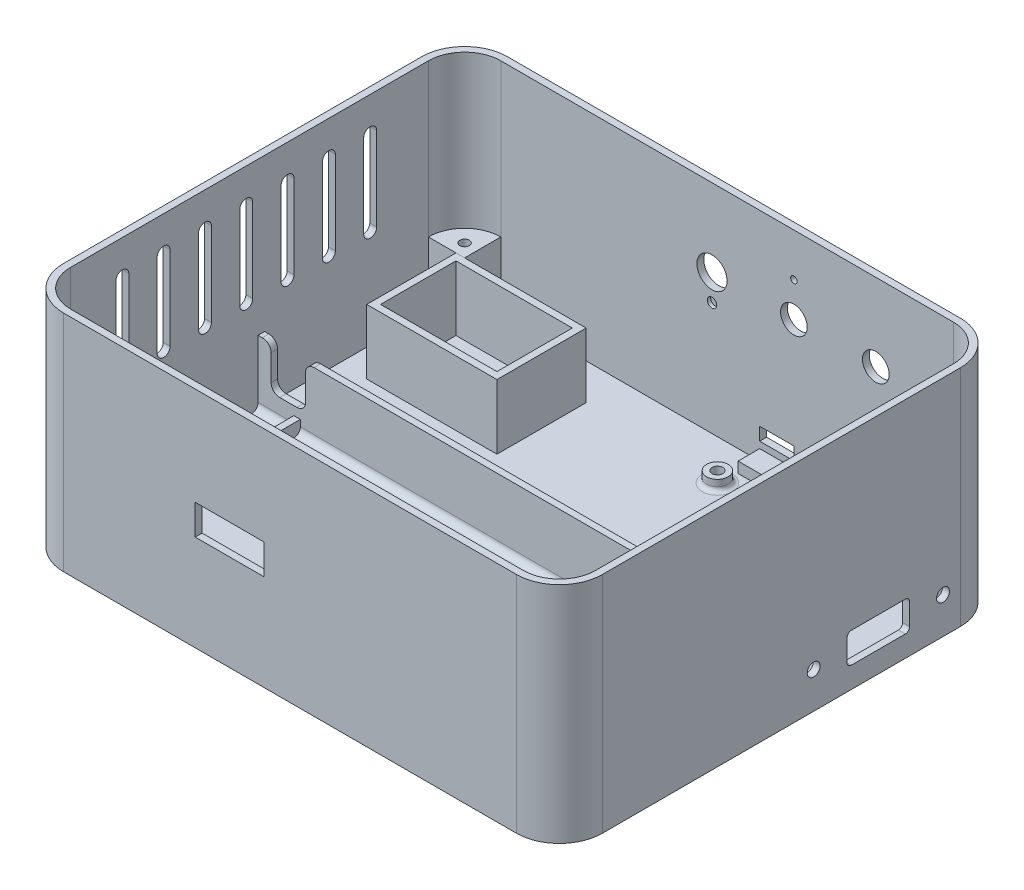
from build123d import *

# Parameters (mm, degrees)
AUFSATZ_LINEAR_AUSTRAGEN1_DEPTH  = 52
SCHALE1_T                        = -1.6
SKIZZE5_W                        = 8.4
SKIZZE5_H                        = 8.4
AUFSATZ_LINEAR_AUSTRAGEN4_DEPTH  = 15
SKIZZE6_R                        = 1.1
SCHNITT_LINEAR_AUSTRAGEN1_DEPTH  = 16.6
SCHNITT_LINEAR_AUSTRAGEN2_REACH  = 170.94
SKIZZE9_W                        = 43.5
SKIZZE9_H                        = 13.3
SKIZZE10_W                       = 48.3
SKIZZE10_H                       = 8.4
SKIZZE10_W_2                     = 121.8
SKIZZE10_H_2                     = 1.5
AUFSATZ_LINEAR_AUSTRAGEN5_DEPTH  = 3
VERRUNDUNG1_R                    = 1.5
SKIZZE11_W                       = 121.8
SKIZZE11_H                       = 1.5
AUFSATZ_LINEAR_AUSTRAGEN6_DEPTH  = 12
AUFSATZ_LINEAR_AUSTRAGEN9_DEPTH  = 1.6
AUFSATZ_LINEAR_AUSTRAGEN10_REACH = 170.762
SKIZZE19_W                       = 1.5
SKIZZE19_H                       = 43.5
SCHNITT_LINEAR_AUSTRAGEN3_REACH  = 172.112
SCHNITT_LINEAR_AUSTRAGEN4_REACH  = 172.112
SKIZZE21_W                       = 16
SKIZZE21_H                       = 7
SKIZZE22_R                       = 2.25
SCHNITT_LINEAR_AUSTRAGEN7_DEPTH  = 12.6
SCHNITT_LINEAR_AUSTRAGEN8_REACH  = 172.112
SKIZZE23_R                       = 3.1
SKIZZE23_R_2                     = 0.75
SCHNITT_LINEAR_AUSTRAGEN9_REACH  = 171.148
SKIZZE24_W                       = 9
SKIZZE24_H                       = 6
SKIZZE25_W                       = 3.2
SKIZZE25_H                       = 4.8
SKIZZE25_H_2                     = 3
AUFSATZ_LINEAR_AUSTRAGEN11_DEPTH = 7.5
SCHNITT_LINEAR_AUSTRAGEN10_REACH = 171.148
SKIZZE26_W                       = 8
SKIZZE26_H                       = 3
SKIZZE27_R                       = 2.5
SKIZZE27_R_2                     = 1.25
SKIZZE27_W                       = 4
SKIZZE27_H                       = 5
AUFSATZ_LINEAR_AUSTRAGEN12_DEPTH = 2.5
VERRUNDUNG4_R                    = 1
SKIZZE29_R                       = 3.5
SCHNITT_LINEAR_AUSTRAGEN11_DEPTH = 0.9
SKIZZE30_W                       = 8
SKIZZE30_H                       = 1.5
SCHNITT_LINEAR_AUSTRAGEN12_DEPTH = 10
VERRUNDUNG5_R                    = 2
SCHNITT_LINEAR_AUSTRAGEN13_REACH = 170.94
SKIZZE31_R                       = 1.5
SKIZZE31_W                       = 14.5
SKIZZE31_H                       = 7
VERRUNDUNG6_R                    = 1
VERRUNDUNG7_R                    = 1
SCHNITT_LINEAR_AUSTRAGEN14_REACH = 172.112
SKIZZE32_R                       = 3.5
SKIZZE33_R                       = 1.1
SCHNITT_LINEAR_AUSTRAGEN15_DEPTH = 0.8
SKIZZE12_W                       = 27
SKIZZE12_H                       = 17.5
AUFSATZ_LINEAR_AUSTRAGEN7_DEPTH  = 15
SKIZZE34_W                       = 9
SKIZZE34_H                       = 2.5
SCHNITT_LINEAR_AUSTRAGEN17_DEPTH = 1.6


with BuildPart() as part:
    # Skizze1 → Aufsatz-Linear austragen1 (new body)
    with BuildSketch(Plane(origin=(0, 0, 0), x_dir=(1, 0, 0), z_dir=(0, 1, 0))):
        with BuildLine():
            Line((10, 0), (115, 0))
            ThreePointArc((115, 0), (122.071067812, 2.928932188), (125, 10))
            Line((125, 10), (125, 93))
            ThreePointArc((125, 93), (122.071067812, 100.071067812), (115, 103))
            Line((115, 103), (10, 103))
            ThreePointArc((10, 103), (2.928932188, 100.071067812), (0, 93))
            Line((0, 93), (0, 10))
            ThreePointArc((0, 10), (2.928932188, 2.928932188), (10, 0))
        make_face()
    extrude(amount=AUFSATZ_LINEAR_AUSTRAGEN1_DEPTH)

    # Schale1
    schale1_openings = [part.faces().sort_by_distance(p)[0] for p in [
        (62.5, 52, -51.5),
    ]]
    offset(amount=SCHALE1_T, openings=schale1_openings, kind=Kind.INTERSECTION)

    # Skizze5 → Aufsatz-Linear austragen4 (add)
    with BuildSketch(Plane(origin=(0, 1.6, 0), x_dir=(1, 0, 0), z_dir=(0, 1, 0))):
        with BuildLine():
            Line((1.6, 93), (10, 93))
            Line((10, 93), (10, 101.4))
            ThreePointArc((10, 101.4), (4.060303038, 98.939696962), (1.6, 93))
        make_face()
        with BuildLine():
            Line((115, 93), (115, 101.4))
            ThreePointArc((115, 101.4), (120.939696962, 98.939696962), (123.4, 93))
            Line((123.4, 93), (115, 93))
        make_face()
        with BuildLine():
            Line((123.4, 10), (115, 10))
            Line((115, 10), (115, 1.6))
            ThreePointArc((115, 1.6), (120.939696962, 4.060303038), (123.4, 10))
        make_face()
        with BuildLine():
            Line((10, 10), (10, 1.6))
            ThreePointArc((10, 1.6), (4.060303038, 4.060303038), (1.6, 10))
            Line((1.6, 10), (10, 10))
        make_face()
        with Locations((62.5, 5.8)):
            Rectangle(SKIZZE5_W, SKIZZE5_H)
    extrude(amount=AUFSATZ_LINEAR_AUSTRAGEN4_DEPTH)

    # Skizze6 → Schnitt-Linear austragen1 (cut)
    with BuildSketch(Plane(origin=(0, 16.6, 0), x_dir=(1, 0, 0), z_dir=(0, 1, 0))):
        with Locations(Location((7, 96, 0), (0, 0, 270))):
            Circle(SKIZZE6_R)
        with Locations(Location((118, 96, 0), (0, 0, 270))):
            Circle(SKIZZE6_R)
        with Locations(Location((118, 7, 0), (0, 0, 270))):
            Circle(SKIZZE6_R)
        with Locations(Location((7, 7, 0), (0, 0, 270))):
            Circle(SKIZZE6_R)
    extrude(amount=-SCHNITT_LINEAR_AUSTRAGEN1_DEPTH, mode=Mode.SUBTRACT)

    # Skizze9 → Schnitt-Linear austragen2 (cut, up to next)
    with BuildSketch(Plane(origin=(1.6, 0, 0), x_dir=(0, 0, -1), z_dir=(1, 0, 0)), mode=Mode.PRIVATE) as schnitt_linear_austragen2_sk1:
        with Locations((31.75, 8.25)):
            Rectangle(SKIZZE9_W, SKIZZE9_H)
    schnitt_linear_austragen2_tool1 = extrude(schnitt_linear_austragen2_sk1.sketch, amount=-SCHNITT_LINEAR_AUSTRAGEN2_REACH, mode=Mode.PRIVATE) & part.part
    add(schnitt_linear_austragen2_tool1.solids().sort_by_distance((1.6, 8.25, -31.75))[0], mode=Mode.SUBTRACT)

    # Skizze10 → Aufsatz-Linear austragen5 (add)
    with BuildSketch(Plane(origin=(0, 1.6, 0), x_dir=(1, 0, 0), z_dir=(0, 1, 0))):
        with Locations((90.85, 5.8)):
            Rectangle(SKIZZE10_W, SKIZZE10_H)
        with Locations((34.15, 5.8)):
            Rectangle(SKIZZE10_W, SKIZZE10_H)
        with Locations((62.5, 54.25)):
            Rectangle(SKIZZE10_W_2, SKIZZE10_H_2)
    extrude(amount=AUFSATZ_LINEAR_AUSTRAGEN5_DEPTH)

    # Verrundung1
    verrundung1_edges = [part.edges().sort_by_distance(p)[0] for p in [
        (61.7, 1.6, -53.5),
        (61.7, 1.6, -10),
    ]]
    fillet(verrundung1_edges, radius=VERRUNDUNG1_R)

    # Skizze11 → Aufsatz-Linear austragen6 (add)
    with BuildSketch(Plane(origin=(0, 4.6, 0), x_dir=(1, 0, 0), z_dir=(0, 1, 0))):
        with Locations((62.5, 54.25)):
            Rectangle(SKIZZE11_W, SKIZZE11_H)
    extrude(amount=AUFSATZ_LINEAR_AUSTRAGEN6_DEPTH)

    # Skizze16 → Aufsatz-Linear austragen9 (add)
    with BuildSketch(Plane.ZY):
        with BuildLine():
            Line((-10, 14.9), (-10, 3.1))
            ThreePointArc((-10, 3.1), (-10.439339828, 2.039339828), (-11.5, 1.6))
            Line((-11.5, 1.6), (-52, 1.6))
            ThreePointArc((-52, 1.6), (-53.060660172, 2.039339828), (-53.5, 3.1))
            Line((-53.5, 3.1), (-53.5, 14.9))
            Line((-53.5, 14.9), (-10, 14.9))
        make_face()
    extrude(amount=-AUFSATZ_LINEAR_AUSTRAGEN9_DEPTH)

    # Skizze19 → Aufsatz-Linear austragen10 (add, up to next)
    with BuildSketch(Plane(origin=(0, 4.6, 0), x_dir=(1, 0, 0), z_dir=(0, 1, 0)), mode=Mode.PRIVATE) as aufsatz_linear_austragen10_sk1:
        with Locations((10.65, 31.75)):
            Rectangle(SKIZZE19_W, SKIZZE19_H)
    aufsatz_linear_austragen10_tool1 = extrude(aufsatz_linear_austragen10_sk1.sketch, amount=-AUFSATZ_LINEAR_AUSTRAGEN10_REACH, mode=Mode.PRIVATE) - part.part
    add(aufsatz_linear_austragen10_tool1.solids().sort_by_distance((10.65, 4.6, -31.75))[0])

    # Skizze20 → Schnitt-Linear austragen3 (cut, up to next)
    with BuildSketch(Plane.ZY, mode=Mode.PRIVATE) as schnitt_linear_austragen3_sk1:
        with BuildLine():
            Line((-78, 44), (-78, 24.6))
            ThreePointArc((-78, 24.6), (-79.5, 23.1), (-81, 24.6))
            Line((-81, 24.6), (-81, 44))
            ThreePointArc((-81, 44), (-79.5, 45.5), (-78, 44))
        make_face()
    schnitt_linear_austragen3_tool1 = extrude(schnitt_linear_austragen3_sk1.sketch, amount=-SCHNITT_LINEAR_AUSTRAGEN3_REACH, mode=Mode.PRIVATE) & part.part
    # Skizze20 → Schnitt-Linear austragen3 (cut, up to next)
    with BuildSketch(Plane.ZY, mode=Mode.PRIVATE) as schnitt_linear_austragen3_sk2:
        with BuildLine():
            Line((-68.416666667, 44), (-68.416666667, 24.6))
            ThreePointArc((-68.416666667, 24.6), (-69.916666667, 23.1), (-71.416666667, 24.6))
            Line((-71.416666667, 24.6), (-71.416666667, 44))
            ThreePointArc((-71.416666667, 44), (-69.916666667, 45.5), (-68.416666667, 44))
        make_face()
    schnitt_linear_austragen3_tool2 = extrude(schnitt_linear_austragen3_sk2.sketch, amount=-SCHNITT_LINEAR_AUSTRAGEN3_REACH, mode=Mode.PRIVATE) & part.part
    # Skizze20 → Schnitt-Linear austragen3 (cut, up to next)
    with BuildSketch(Plane.ZY, mode=Mode.PRIVATE) as schnitt_linear_austragen3_sk3:
        with BuildLine():
            Line((-58.833333333, 44), (-58.833333333, 24.6))
            ThreePointArc((-58.833333333, 24.6), (-60.333333333, 23.1), (-61.833333333, 24.6))
            Line((-61.833333333, 24.6), (-61.833333333, 44))
            ThreePointArc((-61.833333333, 44), (-60.333333333, 45.5), (-58.833333333, 44))
        make_face()
    schnitt_linear_austragen3_tool3 = extrude(schnitt_linear_austragen3_sk3.sketch, amount=-SCHNITT_LINEAR_AUSTRAGEN3_REACH, mode=Mode.PRIVATE) & part.part
    # Skizze20 → Schnitt-Linear austragen3 (cut, up to next)
    with BuildSketch(Plane.ZY, mode=Mode.PRIVATE) as schnitt_linear_austragen3_sk4:
        with BuildLine():
            Line((-49.25, 44), (-49.25, 24.6))
            ThreePointArc((-49.25, 24.6), (-50.75, 23.1), (-52.25, 24.6))
            Line((-52.25, 24.6), (-52.25, 44))
            ThreePointArc((-52.25, 44), (-50.75, 45.5), (-49.25, 44))
        make_face()
    schnitt_linear_austragen3_tool4 = extrude(schnitt_linear_austragen3_sk4.sketch, amount=-SCHNITT_LINEAR_AUSTRAGEN3_REACH, mode=Mode.PRIVATE) & part.part
    # Skizze20 → Schnitt-Linear austragen3 (cut, up to next)
    with BuildSketch(Plane.ZY, mode=Mode.PRIVATE) as schnitt_linear_austragen3_sk5:
        with BuildLine():
            Line((-39.666666667, 44), (-39.666666667, 24.6))
            ThreePointArc((-39.666666667, 24.6), (-41.166666667, 23.1), (-42.666666667, 24.6))
            Line((-42.666666667, 24.6), (-42.666666667, 44))
            ThreePointArc((-42.666666667, 44), (-41.166666667, 45.5), (-39.666666667, 44))
        make_face()
    schnitt_linear_austragen3_tool5 = extrude(schnitt_linear_austragen3_sk5.sketch, amount=-SCHNITT_LINEAR_AUSTRAGEN3_REACH, mode=Mode.PRIVATE) & part.part
    # Skizze20 → Schnitt-Linear austragen3 (cut, up to next)
    with BuildSketch(Plane.ZY, mode=Mode.PRIVATE) as schnitt_linear_austragen3_sk6:
        with BuildLine():
            Line((-30.083333333, 44), (-30.083333333, 24.6))
            ThreePointArc((-30.083333333, 24.6), (-31.583333333, 23.1), (-33.083333333, 24.6))
            Line((-33.083333333, 24.6), (-33.083333333, 44))
            ThreePointArc((-33.083333333, 44), (-31.583333333, 45.5), (-30.083333333, 44))
        make_face()
    schnitt_linear_austragen3_tool6 = extrude(schnitt_linear_austragen3_sk6.sketch, amount=-SCHNITT_LINEAR_AUSTRAGEN3_REACH, mode=Mode.PRIVATE) & part.part
    # Skizze20 → Schnitt-Linear austragen3 (cut, up to next)
    with BuildSketch(Plane.ZY, mode=Mode.PRIVATE) as schnitt_linear_austragen3_sk7:
        with BuildLine():
            Line((-20.5, 44), (-20.5, 24.6))
            ThreePointArc((-20.5, 24.6), (-22, 23.1), (-23.5, 24.6))
            Line((-23.5, 24.6), (-23.5, 44))
            ThreePointArc((-23.5, 44), (-22, 45.5), (-20.5, 44))
        make_face()
    schnitt_linear_austragen3_tool7 = extrude(schnitt_linear_austragen3_sk7.sketch, amount=-SCHNITT_LINEAR_AUSTRAGEN3_REACH, mode=Mode.PRIVATE) & part.part
    add(schnitt_linear_austragen3_tool1.solids().sort_by_distance((0, 34.3, -79.5))[0], mode=Mode.SUBTRACT)
    add(schnitt_linear_austragen3_tool2.solids().sort_by_distance((0, 34.3, -69.916667))[0], mode=Mode.SUBTRACT)
    add(schnitt_linear_austragen3_tool3.solids().sort_by_distance((0, 34.3, -60.333333))[0], mode=Mode.SUBTRACT)
    add(schnitt_linear_austragen3_tool4.solids().sort_by_distance((0, 34.3, -50.75))[0], mode=Mode.SUBTRACT)
    add(schnitt_linear_austragen3_tool5.solids().sort_by_distance((0, 34.3, -41.166667))[0], mode=Mode.SUBTRACT)
    add(schnitt_linear_austragen3_tool6.solids().sort_by_distance((0, 34.3, -31.583333))[0], mode=Mode.SUBTRACT)
    add(schnitt_linear_austragen3_tool7.solids().sort_by_distance((0, 34.3, -22))[0], mode=Mode.SUBTRACT)

    # Skizze21 → Schnitt-Linear austragen4 (cut, up to next)
    with BuildSketch(Plane.XY, mode=Mode.PRIVATE) as schnitt_linear_austragen4_sk1:
        with Locations((48.5, 25.75)):
            Rectangle(SKIZZE21_W, SKIZZE21_H)
    schnitt_linear_austragen4_tool1 = extrude(schnitt_linear_austragen4_sk1.sketch, amount=-SCHNITT_LINEAR_AUSTRAGEN4_REACH, mode=Mode.PRIVATE) & part.part
    add(schnitt_linear_austragen4_tool1.solids().sort_by_distance((48.5, 25.75, 0))[0], mode=Mode.SUBTRACT)

    # Skizze22 → Schnitt-Linear austragen7 (cut)
    with BuildSketch(Plane.XZ):
        with Locations(Location((118, -96, 0), (0, 0, 270))):
            Circle(SKIZZE22_R)
        with Locations(Location((7, -96, 0), (0, 0, 270))):
            Circle(SKIZZE22_R)
        with Locations(Location((7, -7, 0), (0, 0, 270))):
            Circle(SKIZZE22_R)
        with Locations(Location((118, -7, 0), (0, 0, 270))):
            Circle(SKIZZE22_R)
    extrude(amount=-SCHNITT_LINEAR_AUSTRAGEN7_DEPTH, mode=Mode.SUBTRACT)

    # Skizze23 → Schnitt-Linear austragen8 (cut, up to next)
    with BuildSketch(Plane(origin=(0, 0, -103), x_dir=(-1, 0, 0), z_dir=(0, 0, -1)), mode=Mode.PRIVATE) as schnitt_linear_austragen8_sk1:
        with Locations((-97, 34)):
            Circle(SKIZZE23_R)
    schnitt_linear_austragen8_tool1 = extrude(schnitt_linear_austragen8_sk1.sketch, amount=-SCHNITT_LINEAR_AUSTRAGEN8_REACH, mode=Mode.PRIVATE) & part.part
    # Skizze23 → Schnitt-Linear austragen8 (cut, up to next)
    with BuildSketch(Plane(origin=(0, 0, -103), x_dir=(-1, 0, 0), z_dir=(0, 0, -1)), mode=Mode.PRIVATE) as schnitt_linear_austragen8_sk2:
        with Locations((-78, 34)):
            Circle(SKIZZE23_R)
    schnitt_linear_austragen8_tool2 = extrude(schnitt_linear_austragen8_sk2.sketch, amount=-SCHNITT_LINEAR_AUSTRAGEN8_REACH, mode=Mode.PRIVATE) & part.part
    # Skizze23 → Schnitt-Linear austragen8 (cut, up to next)
    with BuildSketch(Plane(origin=(0, 0, -103), x_dir=(-1, 0, 0), z_dir=(0, 0, -1)), mode=Mode.PRIVATE) as schnitt_linear_austragen8_sk3:
        with Locations((-78, 42)):
            Circle(SKIZZE23_R_2)
    schnitt_linear_austragen8_tool3 = extrude(schnitt_linear_austragen8_sk3.sketch, amount=-SCHNITT_LINEAR_AUSTRAGEN8_REACH, mode=Mode.PRIVATE) & part.part
    add(schnitt_linear_austragen8_tool1.solids().sort_by_distance((97, 34, -103))[0], mode=Mode.SUBTRACT)
    add(schnitt_linear_austragen8_tool2.solids().sort_by_distance((78, 34, -103))[0], mode=Mode.SUBTRACT)
    add(schnitt_linear_austragen8_tool3.solids().sort_by_distance((78, 42, -103))[0], mode=Mode.SUBTRACT)

    # Skizze24 → Schnitt-Linear austragen9 (cut, up to next)
    with BuildSketch(Plane.XY.offset(-101.4), mode=Mode.PRIVATE) as schnitt_linear_austragen9_sk1:
        with Locations((92.5, 5.6)):
            Rectangle(SKIZZE24_W, SKIZZE24_H)
    schnitt_linear_austragen9_tool1 = extrude(schnitt_linear_austragen9_sk1.sketch, amount=-SCHNITT_LINEAR_AUSTRAGEN9_REACH, mode=Mode.PRIVATE) & part.part
    add(schnitt_linear_austragen9_tool1.solids().sort_by_distance((92.5, 5.6, -101.4))[0], mode=Mode.SUBTRACT)

    # Skizze25 → Aufsatz-Linear austragen11 (add)
    with BuildSketch(Plane(origin=(0, 1.6, 0), x_dir=(1, 0, 0), z_dir=(0, 1, 0))):
        with Locations((83.025, 99)):
            Rectangle(SKIZZE25_W, SKIZZE25_H)
        with Locations((101.975, 99)):
            Rectangle(SKIZZE25_W, SKIZZE25_H)
        with Locations((83.025, 93.95)):
            Rectangle(SKIZZE25_W, SKIZZE25_H_2)
        with Locations((101.975, 93.95)):
            Rectangle(SKIZZE25_W, SKIZZE25_H_2)
    extrude(amount=AUFSATZ_LINEAR_AUSTRAGEN11_DEPTH)

    # Skizze26 → Schnitt-Linear austragen10 (cut, up to next)
    with BuildSketch(Plane.XY.offset(-101.4), mode=Mode.PRIVATE) as schnitt_linear_austragen10_sk1:
        with Locations((74.06, 7.1)):
            Rectangle(SKIZZE26_W, SKIZZE26_H)
    schnitt_linear_austragen10_tool1 = extrude(schnitt_linear_austragen10_sk1.sketch, amount=-SCHNITT_LINEAR_AUSTRAGEN10_REACH, mode=Mode.PRIVATE) & part.part
    add(schnitt_linear_austragen10_tool1.solids().sort_by_distance((74.06, 7.1, -101.4))[0], mode=Mode.SUBTRACT)

    # Skizze27 → Aufsatz-Linear austragen12 (add)
    # profile 1 of 4: a face of its own
    with BuildSketch(Plane(origin=(0, 1.6, 0), x_dir=(1, 0, 0), z_dir=(0, 1, 0))):
        with Locations((69.56, 92.1)):
            Circle(SKIZZE27_R)
        with Locations(Location((69.56, 92.1, 0), (0, 0, 90))):
            Circle(SKIZZE27_R_2, mode=Mode.SUBTRACT)
    # profile 2 of 4: a face of its own
    with BuildSketch(Plane(origin=(0, 1.6, 0), x_dir=(1, 0, 0), z_dir=(0, 1, 0))):
        with Locations(Location((78.56, 92.1, 0), (0, 0, 90))):
            Circle(SKIZZE27_R)
        with Locations((78.56, 92.1)):
            Circle(SKIZZE27_R_2, mode=Mode.SUBTRACT)
    # profile 3 of 4: a face of its own
    with BuildSketch(Plane(origin=(0, 1.6, 0), x_dir=(1, 0, 0), z_dir=(0, 1, 0))):
        with Locations((76.06, 98.9)):
            Rectangle(SKIZZE27_W, SKIZZE27_H)
    # profile 4 of 4: a face of its own
    with BuildSketch(Plane(origin=(0, 1.6, 0), x_dir=(1, 0, 0), z_dir=(0, 1, 0))):
        with Locations((72.06, 98.9)):
            Rectangle(SKIZZE27_W, SKIZZE27_H)
    extrude(amount=AUFSATZ_LINEAR_AUSTRAGEN12_DEPTH)

    # Verrundung4
    # the kernel refuses this fillet: 1 mm, written as the material it adds along each edge
    with BuildSketch(Plane(origin=(69.56, 1.6, -92.1), x_dir=(1, 0, 0), z_dir=(0, 0, 1))) as verrundung4_piece_1:
        with BuildLine():
            CenterArc((2.5 + VERRUNDUNG4_R, VERRUNDUNG4_R), VERRUNDUNG4_R, 180, 90)
            Line((2.5, VERRUNDUNG4_R), (2.5, 0))
            Line((2.5, 0), (2.5 + VERRUNDUNG4_R, 0))
        make_face()
    revolve(axis=Axis((69.56, 1.6, -92.1), (0, 1, 0)))
    with BuildSketch(Plane(origin=(78.56, 1.6, -92.1), x_dir=(0, 0, -1), z_dir=(1, 0, 0))) as verrundung4_piece_2:
        with BuildLine():
            CenterArc((2.5 + VERRUNDUNG4_R, VERRUNDUNG4_R), VERRUNDUNG4_R, 180, 90)
            Line((2.5, VERRUNDUNG4_R), (2.5, 0))
            Line((2.5, 0), (2.5 + VERRUNDUNG4_R, 0))
        make_face()
    revolve(axis=Axis((78.56, 1.6, -92.1), (0, 1, 0)))

    # Skizze29 → Schnitt-Linear austragen11 (cut)
    with BuildSketch(Plane.XY.offset(-1.6)):
        with Locations(Location((69.5, 25.35, 0), (0, 0, 180))):
            Circle(SKIZZE29_R)
    extrude(amount=SCHNITT_LINEAR_AUSTRAGEN11_DEPTH, mode=Mode.SUBTRACT)

    # Skizze30 → Schnitt-Linear austragen12 (cut)
    with BuildSketch(Plane(origin=(0, 16.6, 0), x_dir=(1, 0, 0), z_dir=(0, 1, 0))):
        with Locations((8.6, 54.25)):
            Rectangle(SKIZZE30_W, SKIZZE30_H)
    extrude(amount=-SCHNITT_LINEAR_AUSTRAGEN12_DEPTH, mode=Mode.SUBTRACT)

    # Verrundung5
    verrundung5_edges = [part.edges().sort_by_distance(p)[0] for p in [
        (12.6, 6.6, -54.25),
        (4.6, 6.6, -54.25),
        (12.6, 16.6, -54.25),
        (4.6, 16.6, -54.25),
    ]]
    fillet(verrundung5_edges, radius=VERRUNDUNG5_R)

    # Skizze31 → Schnitt-Linear austragen13 (cut, up to next)
    with BuildSketch(Plane.ZY.offset(-123.4), mode=Mode.PRIVATE) as schnitt_linear_austragen13_sk1:
        with Locations((-59, 8.4)):
            Circle(SKIZZE31_R)
    schnitt_linear_austragen13_tool1 = extrude(schnitt_linear_austragen13_sk1.sketch, amount=-SCHNITT_LINEAR_AUSTRAGEN13_REACH, mode=Mode.PRIVATE) & part.part
    # Skizze31 → Schnitt-Linear austragen13 (cut, up to next)
    with BuildSketch(Plane.ZY.offset(-123.4), mode=Mode.PRIVATE) as schnitt_linear_austragen13_sk2:
        with Locations((-89, 8.4)):
            Circle(SKIZZE31_R)
    schnitt_linear_austragen13_tool2 = extrude(schnitt_linear_austragen13_sk2.sketch, amount=-SCHNITT_LINEAR_AUSTRAGEN13_REACH, mode=Mode.PRIVATE) & part.part
    # Skizze31 → Schnitt-Linear austragen13 (cut, up to next)
    with BuildSketch(Plane.ZY.offset(-123.4), mode=Mode.PRIVATE) as schnitt_linear_austragen13_sk3:
        with Locations((-74, 8.4)):
            Rectangle(SKIZZE31_W, SKIZZE31_H)
    schnitt_linear_austragen13_tool3 = extrude(schnitt_linear_austragen13_sk3.sketch, amount=-SCHNITT_LINEAR_AUSTRAGEN13_REACH, mode=Mode.PRIVATE) & part.part
    add(schnitt_linear_austragen13_tool1.solids().sort_by_distance((123.4, 8.4, -59))[0], mode=Mode.SUBTRACT)
    add(schnitt_linear_austragen13_tool2.solids().sort_by_distance((123.4, 8.4, -89))[0], mode=Mode.SUBTRACT)
    add(schnitt_linear_austragen13_tool3.solids().sort_by_distance((123.4, 8.4, -74))[0], mode=Mode.SUBTRACT)

    # Verrundung6
    verrundung6_edges = [part.edges().sort_by_distance(p)[0] for p in [
        (124.2, 4.9, -81.25),
        (124.2, 11.9, -81.25),
        (124.2, 11.9, -66.75),
        (124.2, 4.9, -66.75),
    ]]
    fillet(verrundung6_edges, radius=VERRUNDUNG6_R)

    # Verrundung7
    # the kernel refuses this fillet: 1 mm, written as the material it adds along each edge
    with BuildSketch(Plane(origin=(81.425, 1.6, -91.610416623), x_dir=(-1, 0, 0), z_dir=(0, 0, -1))) as verrundung7_piece_1_section:
        with BuildLine():
            CenterArc((VERRUNDUNG7_R, VERRUNDUNG7_R), VERRUNDUNG7_R, 180, 90)
            Line((0, VERRUNDUNG7_R), (0, 0))
            Line((0, 0), (VERRUNDUNG7_R, 0))
        make_face()
    verrundung7_piece_1 = extrude(amount=3.839583377, mode=Mode.PRIVATE)
    verrundung7_piece_1 = split(verrundung7_piece_1, bisect_by=Plane(origin=(81.263865527, 1.903531011, -92.45), z_dir=(0, 0, -1)), keep=Keep.TOP, mode=Mode.PRIVATE)
    add(verrundung7_piece_1)
    with BuildSketch(Plane(origin=(81.425, 1.6, -91.610416623), x_dir=(-1, 0, 0), z_dir=(0, 0, -1))) as verrundung7_piece_2_section:
        with BuildLine():
            CenterArc((VERRUNDUNG7_R, VERRUNDUNG7_R), VERRUNDUNG7_R, 180, 90)
            Line((0, VERRUNDUNG7_R), (0, 0))
            Line((0, 0), (VERRUNDUNG7_R, 0))
        make_face()
    verrundung7_piece_2 = extrude(amount=6.339583377, mode=Mode.PRIVATE)
    verrundung7_piece_2 = split(verrundung7_piece_2, bisect_by=Plane(origin=(81.201632061, 1.823367939, -96.6), z_dir=(0, 0, -1)), keep=Keep.TOP, mode=Mode.PRIVATE)
    add(verrundung7_piece_2)
    with BuildSketch(Plane(origin=(81.425, 1.6, -94.1), x_dir=(-1, 0, 0), z_dir=(0, 0, -1))) as verrundung7_piece_3_section:
        with BuildLine():
            CenterArc((VERRUNDUNG7_R, VERRUNDUNG7_R), VERRUNDUNG7_R, 180, 90)
            Line((0, VERRUNDUNG7_R), (0, 0))
            Line((0, 0), (VERRUNDUNG7_R, 0))
        make_face()
    verrundung7_piece_3 = extrude(amount=9.8, mode=Mode.PRIVATE)
    verrundung7_piece_3 = split(verrundung7_piece_3, bisect_by=Plane(origin=(81.224124387, 1.866931824, -95.45), z_dir=(0, 0, 1)), keep=Keep.TOP, mode=Mode.PRIVATE)
    add(verrundung7_piece_3)
    with BuildSketch(Plane(origin=(81.425, 1.6, -96.6), x_dir=(-1, 0, 0), z_dir=(0, 0, -1)), Plane(origin=(84.625, 1.6, -101.4), x_dir=(1, 0, 0), z_dir=(0, 0, 1)), Plane(origin=(100.375, 1.6, -96.6), x_dir=(-1, 0, 0), z_dir=(0, 0, -1)), Plane(origin=(103.575, 1.6, -101.4), x_dir=(1, 0, 0), z_dir=(0, 0, 1))) as verrundung7_piece_4:
        with BuildLine():
            CenterArc((VERRUNDUNG7_R, VERRUNDUNG7_R), VERRUNDUNG7_R, 180, 90)
            Line((0, VERRUNDUNG7_R), (0, 0))
            Line((0, 0), (VERRUNDUNG7_R, 0))
        make_face()
    extrude(amount=4.8)
    with BuildSketch(Plane(origin=(84.625, 1.6, -103.9), x_dir=(1, 0, 0), z_dir=(0, 0, 1))) as verrundung7_piece_5_section:
        with BuildLine():
            CenterArc((VERRUNDUNG7_R, VERRUNDUNG7_R), VERRUNDUNG7_R, 180, 90)
            Line((0, VERRUNDUNG7_R), (0, 0))
            Line((0, 0), (VERRUNDUNG7_R, 0))
        make_face()
    verrundung7_piece_5 = extrude(amount=9.8, mode=Mode.PRIVATE)
    verrundung7_piece_5 = split(verrundung7_piece_5, bisect_by=Plane(origin=(84.848367939, 1.823367939, -95.45), z_dir=(0, 0, 1)), keep=Keep.TOP, mode=Mode.PRIVATE)
    add(verrundung7_piece_5)
    with BuildSketch(Plane(origin=(84.625, 1.6, -97.95), x_dir=(1, 0, 0), z_dir=(0, 0, 1))) as verrundung7_piece_6_section:
        with BuildLine():
            CenterArc((VERRUNDUNG7_R, VERRUNDUNG7_R), VERRUNDUNG7_R, 180, 90)
            Line((0, VERRUNDUNG7_R), (0, 0))
            Line((0, 0), (VERRUNDUNG7_R, 0))
        make_face()
    verrundung7_piece_6 = extrude(amount=8, mode=Mode.PRIVATE)
    verrundung7_piece_6 = split(verrundung7_piece_6, bisect_by=Plane(origin=(84.848367939, 1.823367939, -96.6), z_dir=(0, 0, -1)), keep=Keep.TOP, mode=Mode.PRIVATE)
    add(verrundung7_piece_6)
    with BuildSketch(Plane(origin=(84.625, 1.6, -95.45), x_dir=(1, 0, 0), z_dir=(0, 0, 1)), Plane(origin=(100.375, 1.6, -92.45), x_dir=(-1, 0, 0), z_dir=(0, 0, -1)), Plane(origin=(103.575, 1.6, -95.45), x_dir=(1, 0, 0), z_dir=(0, 0, 1))) as verrundung7_piece_7:
        with BuildLine():
            CenterArc((VERRUNDUNG7_R, VERRUNDUNG7_R), VERRUNDUNG7_R, 180, 90)
            Line((0, VERRUNDUNG7_R), (0, 0))
            Line((0, 0), (VERRUNDUNG7_R, 0))
        make_face()
    extrude(amount=3)
    with BuildSketch(Plane(origin=(100.375, 1.6, -94.1), x_dir=(-1, 0, 0), z_dir=(0, 0, -1))) as verrundung7_piece_8_section:
        with BuildLine():
            CenterArc((VERRUNDUNG7_R, VERRUNDUNG7_R), VERRUNDUNG7_R, 180, 90)
            Line((0, VERRUNDUNG7_R), (0, 0))
            Line((0, 0), (VERRUNDUNG7_R, 0))
        make_face()
    verrundung7_piece_8 = extrude(amount=9.8, mode=Mode.PRIVATE)
    verrundung7_piece_8 = split(verrundung7_piece_8, bisect_by=Plane(origin=(100.151632061, 1.823367939, -95.45), z_dir=(0, 0, 1)), keep=Keep.TOP, mode=Mode.PRIVATE)
    add(verrundung7_piece_8)
    with BuildSketch(Plane(origin=(100.375, 1.6, -89.95), x_dir=(-1, 0, 0), z_dir=(0, 0, -1))) as verrundung7_piece_9_section:
        with BuildLine():
            CenterArc((VERRUNDUNG7_R, VERRUNDUNG7_R), VERRUNDUNG7_R, 180, 90)
            Line((0, VERRUNDUNG7_R), (0, 0))
            Line((0, 0), (VERRUNDUNG7_R, 0))
        make_face()
    verrundung7_piece_9 = extrude(amount=8, mode=Mode.PRIVATE)
    verrundung7_piece_9 = split(verrundung7_piece_9, bisect_by=Plane(origin=(100.151632061, 1.823367939, -96.6), z_dir=(0, 0, -1)), keep=Keep.TOP, mode=Mode.PRIVATE)
    add(verrundung7_piece_9)
    with BuildSketch(Plane(origin=(103.575, 1.6, -97.95), x_dir=(1, 0, 0), z_dir=(0, 0, 1))) as verrundung7_piece_10_section:
        with BuildLine():
            CenterArc((VERRUNDUNG7_R, VERRUNDUNG7_R), VERRUNDUNG7_R, 180, 90)
            Line((0, VERRUNDUNG7_R), (0, 0))
            Line((0, 0), (VERRUNDUNG7_R, 0))
        make_face()
    verrundung7_piece_10 = extrude(amount=8, mode=Mode.PRIVATE)
    verrundung7_piece_10 = split(verrundung7_piece_10, bisect_by=Plane(origin=(103.798367939, 1.823367939, -96.6), z_dir=(0, 0, -1)), keep=Keep.TOP, mode=Mode.PRIVATE)
    add(verrundung7_piece_10)
    with BuildSketch(Plane(origin=(103.575, 1.6, -103.9), x_dir=(1, 0, 0), z_dir=(0, 0, 1))) as verrundung7_piece_11_section:
        with BuildLine():
            CenterArc((VERRUNDUNG7_R, VERRUNDUNG7_R), VERRUNDUNG7_R, 180, 90)
            Line((0, VERRUNDUNG7_R), (0, 0))
            Line((0, 0), (VERRUNDUNG7_R, 0))
        make_face()
    verrundung7_piece_11 = extrude(amount=9.8, mode=Mode.PRIVATE)
    verrundung7_piece_11 = split(verrundung7_piece_11, bisect_by=Plane(origin=(103.798367939, 1.823367939, -95.45), z_dir=(0, 0, 1)), keep=Keep.TOP, mode=Mode.PRIVATE)
    add(verrundung7_piece_11)
    # the kernel refuses this fillet: 1 mm, written as the material it takes off along each edge
    with BuildSketch(Plane(origin=(87.125, 9.1, -96.6), x_dir=(0, -1, 0), z_dir=(-1, 0, 0)), Plane(origin=(106.075, 9.1, -96.6), x_dir=(0, -1, 0), z_dir=(-1, 0, 0))) as verrundung7_2_piece_1:
        with BuildLine():
            CenterArc((VERRUNDUNG7_R, -VERRUNDUNG7_R), VERRUNDUNG7_R, 90, 90)
            Line((0, -VERRUNDUNG7_R), (0, 0))
            Line((0, 0), (VERRUNDUNG7_R, 0))
        make_face()
    extrude(amount=8.2, mode=Mode.SUBTRACT)
    with BuildSketch(Plane(origin=(78.925, 9.1, -95.45), x_dir=(0, 0, 1), z_dir=(1, 0, 0)), Plane(origin=(97.875, 9.1, -95.45), x_dir=(0, 0, 1), z_dir=(1, 0, 0))) as verrundung7_2_piece_2:
        with BuildLine():
            CenterArc((VERRUNDUNG7_R, VERRUNDUNG7_R), VERRUNDUNG7_R, 180, 90)
            Line((0, VERRUNDUNG7_R), (0, 0))
            Line((0, 0), (VERRUNDUNG7_R, 0))
        make_face()
    extrude(amount=8.2, mode=Mode.SUBTRACT)

    # Skizze32 → Schnitt-Linear austragen14 (cut, up to next)
    with BuildSketch(Plane(origin=(0, 0, -103), x_dir=(-1, 0, 0), z_dir=(0, 0, -1)), mode=Mode.PRIVATE) as schnitt_linear_austragen14_sk1:
        with Locations((-59, 34)):
            Circle(SKIZZE32_R)
    schnitt_linear_austragen14_tool1 = extrude(schnitt_linear_austragen14_sk1.sketch, amount=-SCHNITT_LINEAR_AUSTRAGEN14_REACH, mode=Mode.PRIVATE) & part.part
    add(schnitt_linear_austragen14_tool1.solids().sort_by_distance((59, 34, -103))[0], mode=Mode.SUBTRACT)

    # Skizze33 → Schnitt-Linear austragen15 (cut)
    with BuildSketch(Plane.XY.offset(-101.4)):
        with Locations((59, 27.9)):
            Circle(SKIZZE33_R)
    extrude(amount=-SCHNITT_LINEAR_AUSTRAGEN15_DEPTH, mode=Mode.SUBTRACT)

    # Skizze34 → Schnitt-Linear austragen17 (cut)
    with BuildSketch(Plane.ZY):
        with Locations((-19, 7.85)):
            Rectangle(SKIZZE34_W, SKIZZE34_H)
    extrude(amount=-SCHNITT_LINEAR_AUSTRAGEN17_DEPTH, mode=Mode.SUBTRACT)


with BuildPart() as body_2:
    # Skizze12 → Aufsatz-Linear austragen7 (new body)
    with BuildSketch(Plane(origin=(0, 1.6, 0), x_dir=(1, 0, 0), z_dir=(0, 1, 0))):
        Polygon((10, 93), (8, 93), (8, 72.3), (38.2, 72.3), (38.2, 93), align=None)
        with Locations((23.1, 82.65)):
            Rectangle(SKIZZE12_W, SKIZZE12_H, mode=Mode.SUBTRACT)
    extrude(amount=AUFSATZ_LINEAR_AUSTRAGEN7_DEPTH)


solid = Compound([part.part, body_2.part])
